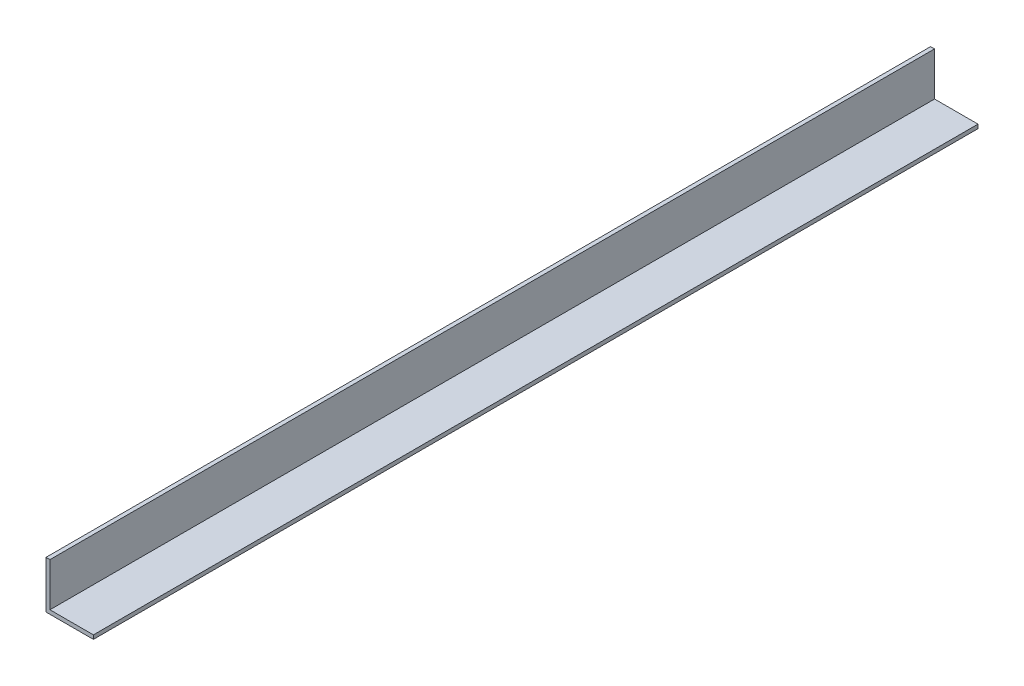
from build123d import *

# Parameters (mm, degrees)
BOSS_EXTRUDE1_DEPTH = 355.6


with BuildPart() as part:
    # Sketch2 → Boss-Extrude1 (new body)
    with BuildSketch(Plane.XY):
        Polygon((0, -9.525), (0, 9.525), (1.5875, 9.525), (1.5875, -7.9375), (19.05, -7.9375), (19.05, -9.525), align=None)
    extrude(amount=BOSS_EXTRUDE1_DEPTH)


solid = part.part
